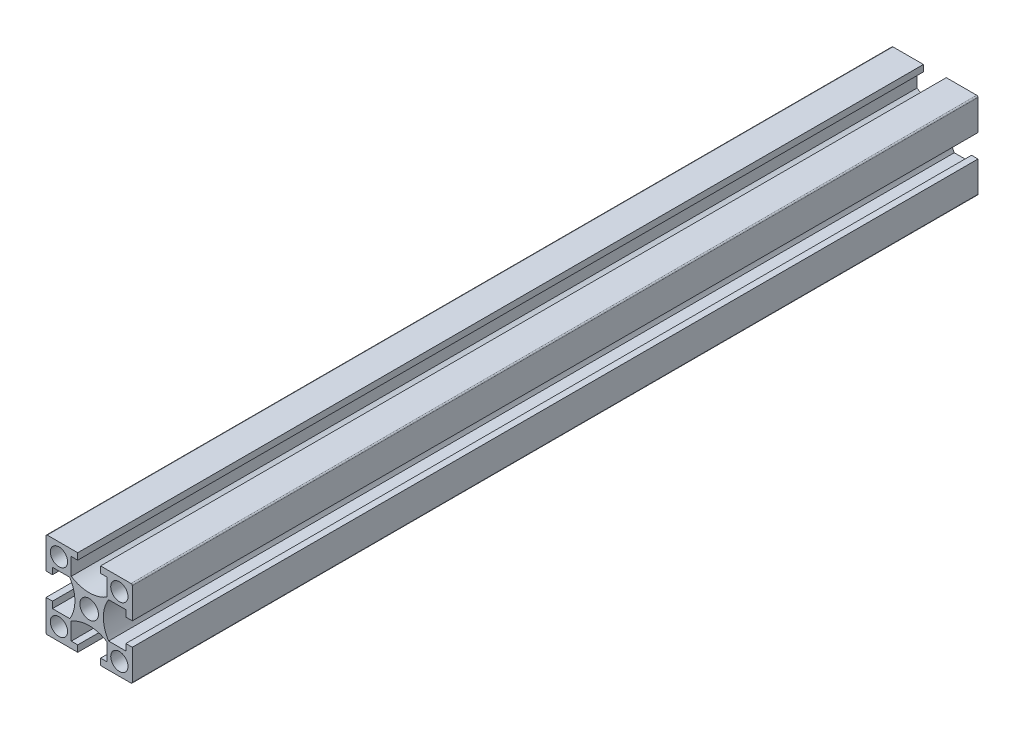
from build123d import *

# Parameters (mm, degrees)
SKETCH_1_W               = 20
SKETCH_1_H               = 20
SKETCH_1_R               = 2
SKETCH_1_R_2             = 2.15
EXTRUDE_1_DEPTH          = 196
CUT_EXTRUDE_1_REACH      = 198.51
PATTERN_CIRCULAR_1_COUNT = 4
FILLET_1_R               = 0.3


with BuildPart() as part:
    # 스케치1 → 보스-돌출1 (new body)
    with BuildSketch(Plane.XY):
        Rectangle(SKETCH_1_W, SKETCH_1_H)
        with Locations((-7, -7)):
            Circle(SKETCH_1_R, mode=Mode.SUBTRACT)
        with Locations((7, -7)):
            Circle(SKETCH_1_R, mode=Mode.SUBTRACT)
        with Locations((-7, 7)):
            Circle(SKETCH_1_R, mode=Mode.SUBTRACT)
        Circle(SKETCH_1_R_2, mode=Mode.SUBTRACT)
        with Locations((7, 7)):
            Circle(SKETCH_1_R, mode=Mode.SUBTRACT)
    extrude(amount=EXTRUDE_1_DEPTH)

    # 스케치1<3> → 컷-돌출1 (cut, up to next)
    with BuildSketch(Plane.XY, mode=Mode.PRIVATE) as cut_extrude_1_sk1:
        with BuildLine():
            Line((-8.5, 2.65), (-10, 2.65))
            Line((-10, 2.65), (-10, -2.65))
            Line((-10, -2.65), (-8.5, -2.65))
            Line((-8.5, -2.65), (-8.5, -4.15))
            Line((-8.5, -4.15), (-4.503166667, -4.15))
            ThreePointArc((-4.503166667, -4.15), (-3.3, 0), (-4.503166667, 4.15))
            Line((-4.503166667, 4.15), (-8.5, 4.15))
            Line((-8.5, 4.15), (-8.5, 2.65))
        make_face()
    cut_extrude_1_tool1 = extrude(cut_extrude_1_sk1.sketch, amount=CUT_EXTRUDE_1_REACH, mode=Mode.PRIVATE) & part.part
    cut_extrude_1 = cut_extrude_1_tool1.solids().sort_by_distance((-6.606913, 0, 0))[0]
    add(cut_extrude_1, mode=Mode.SUBTRACT)

    # 원형 패턴1: 컷-돌출1 ×4 about axis
    pattern_circular_1_axis = Axis((0, 0, 196), (0, 0, -1))
    for i in range(1, PATTERN_CIRCULAR_1_COUNT):
        add(cut_extrude_1.rotate(pattern_circular_1_axis, i * 360 / PATTERN_CIRCULAR_1_COUNT), mode=Mode.SUBTRACT)

    # 필렛1
    fillet_1_edges = [part.edges().sort_by_distance(p)[0] for p in [
        (10, -10, 98),
        (-10, -10, 98),
        (-10, 10, 98),
        (10, 10, 98),
    ]]
    fillet(fillet_1_edges, radius=FILLET_1_R)


solid = part.part
